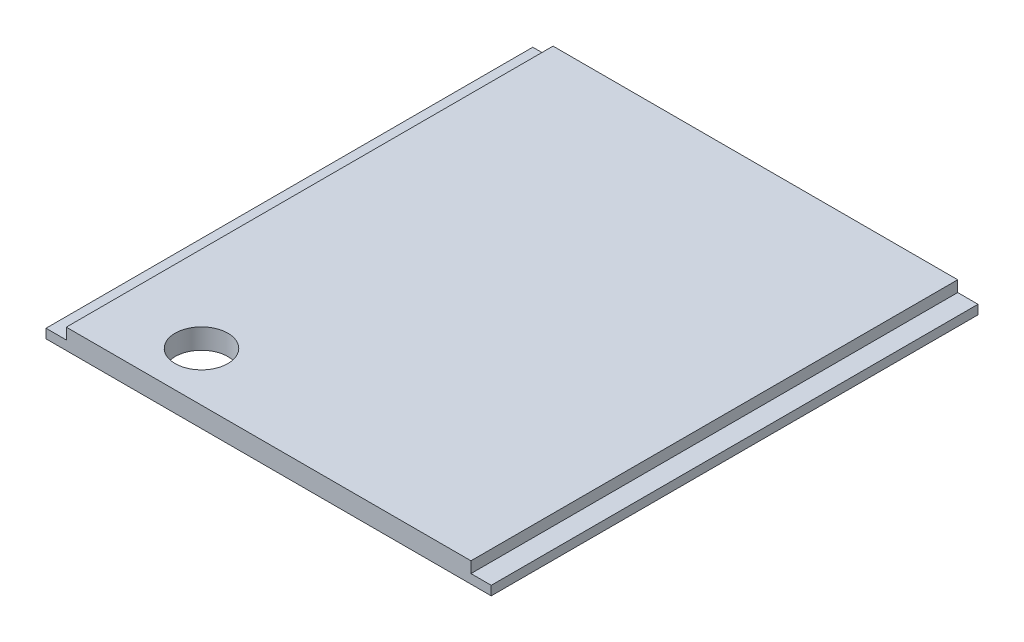
from build123d import *

# Parameters (mm, degrees)
SKETCH1_W           = 139.40028
SKETCH1_H           = 152.4
BOSS_EXTRUDE1_DEPTH = 6.35
SKETCH2_W           = 6.35
SKETCH2_H           = 152.4
CUT_EXTRUDE1_DEPTH  = 3.47472
SKETCH3_R           = 8.255
CUT_EXTRUDE2_DEPTH  = 207.636203421


with BuildPart() as part:
    # Sketch1 → Boss-Extrude1 (new body)
    with BuildSketch(Plane(origin=(0, 0, 0), x_dir=(1, 0, 0), z_dir=(0, 1, 0))):
        with Locations((69.70014, 76.2)):
            Rectangle(SKETCH1_W, SKETCH1_H)
    extrude(amount=BOSS_EXTRUDE1_DEPTH)

    # Sketch2 → Cut-Extrude1 (cut)
    with BuildSketch(Plane(origin=(0, 6.35, 0), x_dir=(1, 0, 0), z_dir=(0, 1, 0))):
        with Locations((3.175, 76.2)):
            Rectangle(SKETCH2_W, SKETCH2_H)
        with Locations((136.22528, 76.2)):
            Rectangle(SKETCH2_W, SKETCH2_H)
    extrude(amount=-CUT_EXTRUDE1_DEPTH, mode=Mode.SUBTRACT)

    # Sketch3 → Cut-Extrude2 (cut, through all)
    with BuildSketch(Plane(origin=(0, 6.35, 0), x_dir=(1, 0, 0), z_dir=(0, 1, 0))):
        with Locations((33.274, 15.408402902)):
            Circle(SKETCH3_R)
    extrude(amount=-CUT_EXTRUDE2_DEPTH, mode=Mode.SUBTRACT)


solid = part.part
